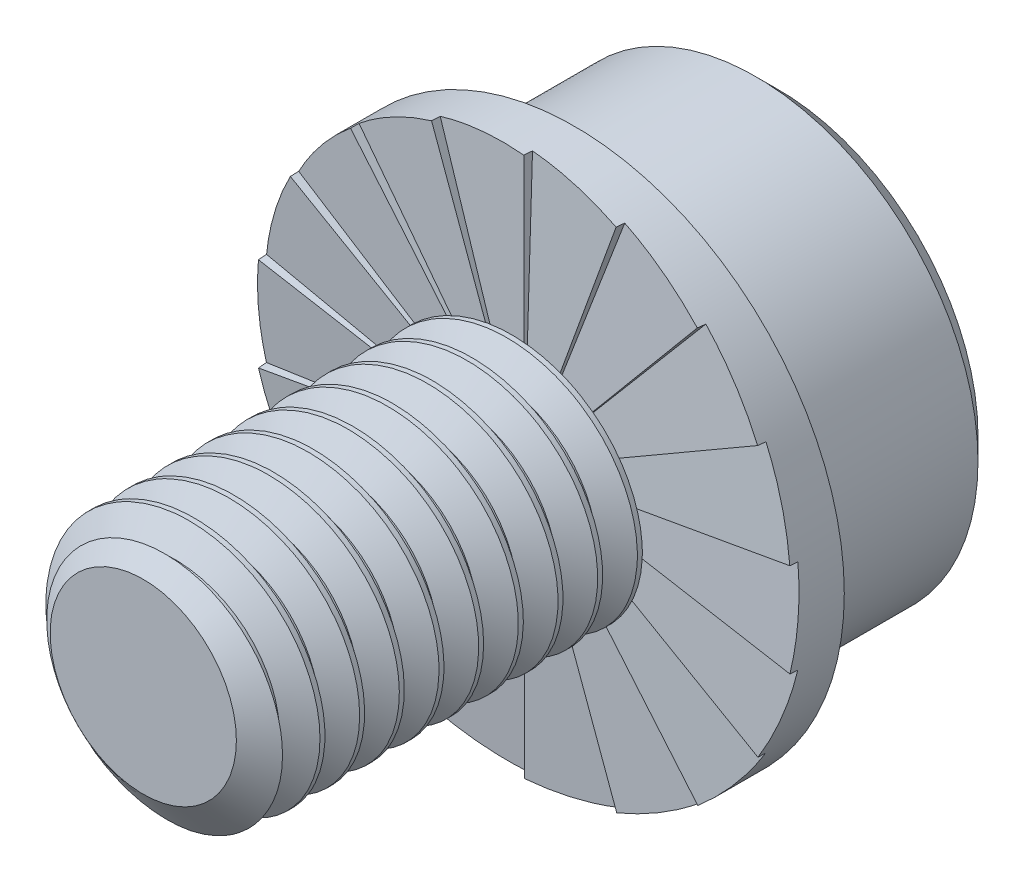
from build123d import *

# Parameters (mm, degrees)
SKETCH1_R           = 4
EXTRUDE1_DEPTH      = 12
CUT_SWEEP1_PITCH    = 1.25
SKETCH6_R           = 7
EXTRUDE2_DEPTH      = 8
SKETCH10_R          = 8.5
BOSS_EXTRUDE1_DEPTH = 1.5875
CUT_EXTRUDE5_DEPTH  = 1.5875
CIRPATTERN1_COUNT   = 18
BOSS_EXTRUDE2_REACH = 18.985
CUT_EXTRUDE1_DEPTH  = 4.5
CHAMFER1_SIZE       = 0.7
FILLET1_R           = 0.396875


with BuildPart() as part:
    # Sketch1 → Extrude1 (new body)
    with BuildSketch(Plane.XY):
        Circle(SKETCH1_R)
    extrude(amount=-EXTRUDE1_DEPTH)

    # Cut-Sweep1: the profile of Sketch3 profile screwed along a right-hand helix of 10.6 turns, 6 arcs to a turn; built about Z, then put on its axis
    cut_sweep1_z = Axis((0, 0, 0), (0, 0, 1))
    cut_sweep1_corners = [(4.0003, 0, -1.093923205), (3.188101184, 0, -0.625), (3.188101184, 0, -0.46875), (4.0003, 0, 0.000173205)]
    with BuildLine(mode=Mode.PRIVATE) as cut_sweep1_profile:
        Line(cut_sweep1_corners[0], cut_sweep1_corners[1])
        Line(cut_sweep1_corners[1], cut_sweep1_corners[2])
        Line(cut_sweep1_corners[2], cut_sweep1_corners[3])
        Line(cut_sweep1_corners[3], cut_sweep1_corners[0])
    cut_sweep1_cap = Face(cut_sweep1_profile.wire())
    cut_sweep1_turn_angles = [0, 30, 60, 90, 120, 150, 180, 210, 240, 270, 300, 330, 360]
    cut_sweep1_turn_weights = [1, 0.8660254037844387, 1, 0.8660254037844387, 1, 0.8660254037844387, 1, 0.8660254037844387, 1, 0.8660254037844387, 1, 0.8660254037844387, 1]
    cut_sweep1_turn_rails = [Edge.make_bspline([Vector(p[0], p[1], 0).rotate(cut_sweep1_z, cut_sweep1_turn_angles[k]) / cut_sweep1_turn_weights[k] + Vector(0, 0, p[2] + CUT_SWEEP1_PITCH * cut_sweep1_turn_angles[k] / 360) for k in range(13)], [0, 0, 0, 1, 1, 2, 2, 3, 3, 4, 4, 5, 5, 6, 6, 6], 2, cut_sweep1_turn_weights) for p in cut_sweep1_corners]
    cut_sweep1_turn_sides = [Face.make_surface_from_curves(cut_sweep1_turn_rails[p[0]], cut_sweep1_turn_rails[p[1]]) for p in [(0, 1), (1, 2), (2, 3), (3, 0)]]
    cut_sweep1_last_angles = [3600, 3630, 3660, 3690, 3720, 3750, 3780, 3798, 3816]
    cut_sweep1_last_weights = [1, 0.8660254037844387, 1, 0.8660254037844387, 1, 0.8660254037844387, 1, 0.9510565162950726, 1]
    cut_sweep1_last_rails = [Edge.make_bspline([Vector(p[0], p[1], 0).rotate(cut_sweep1_z, cut_sweep1_last_angles[k]) / cut_sweep1_last_weights[k] + Vector(0, 0, p[2] + CUT_SWEEP1_PITCH * cut_sweep1_last_angles[k] / 360) for k in range(9)], [0, 0, 0, 1, 1, 2, 2, 3, 3, 4, 4, 4], 2, cut_sweep1_last_weights) for p in cut_sweep1_corners]
    cut_sweep1_last_sides = [Face.make_surface_from_curves(cut_sweep1_last_rails[p[0]], cut_sweep1_last_rails[p[1]]) for p in [(0, 1), (1, 2), (2, 3), (3, 0)]]
    cut_sweep1 = Plane(origin=(0, 0, 0), x_dir=(0, 1, 0), z_dir=(0, 0, -1)) * Solid(Shell([*[p.moved(Location((0, 0, CUT_SWEEP1_PITCH * i))) for i in range(10) for p in cut_sweep1_turn_sides], *cut_sweep1_last_sides, cut_sweep1_cap, cut_sweep1_cap.rotate(cut_sweep1_z, 3816).moved(Location((0, 0, CUT_SWEEP1_PITCH * 3816 / 360)))]))
    add(cut_sweep1, mode=Mode.SUBTRACT)

    # Sketch4 → Cut-Revolve1 (revolve, cut)
    with BuildSketch(Plane(origin=(0, 0, 0), x_dir=(0, 0, -1), z_dir=(1, 0, 0)), mode=Mode.PRIVATE) as cut_revolve1_sk:
        Polygon((0.746350386, 4), (0, 2.934101184), (0, 4), align=None)
    revolve(cut_revolve1_sk.sketch.rotate(Axis((0, 0, 0), (0, 0, -1)), 230.713364492), axis=Axis((0, 0, 0), (0, 0, -1)), mode=Mode.SUBTRACT)


with BuildPart() as body_2:
    # Sketch6 → Extrude2 (new body)
    with BuildSketch(Plane(origin=(0, 0, -12), x_dir=(-1, 0, 0), z_dir=(0, 0, -1))):
        Circle(SKETCH6_R)
    extrude(amount=EXTRUDE2_DEPTH)

    # Sketch10 → Boss-Extrude1 (add)
    with BuildSketch(Plane.XY.offset(-12)):
        Circle(SKETCH10_R)
    extrude(amount=-BOSS_EXTRUDE1_DEPTH)

    # Sketch19 → Cut-Extrude5 (cut)
    with BuildSketch(Plane(origin=(1.041889066, 0, -11.908846518), x_dir=(-0.996194698091745, 0, -0.08715574274766483), z_dir=(0.08715574274766483, 0, -0.996194698091745))):
        with BuildLine():
            Line((1.045868913, 0), (1.045868913, 11.040000007))
            add(Edge.make_bspline(
                [(4.820493474, 10.370695747), (4.293893491, 10.563598892), (3.755613373, 10.715035313), (2.499804163, 10.967069667), (1.769198234, 11.039743484), (1.04847075, 11.039999769), (1.047169824, 11.040000002), (1.045868913, 11.040000007)],
                knots=[0.444410142, 0.444410142, 0.444410142, 0.444410142, 0.46875, 0.46875, 0.5, 0.5, 0.500056509, 0.500056509, 0.500056509, 0.500056509], degree=3))
            Line((4.820493474, 10.370695747), (1.045868913, 0))
        make_face()
    cut_extrude5 = extrude(amount=-CUT_EXTRUDE5_DEPTH, mode=Mode.SUBTRACT)

    # CirPattern1: Cut-Extrude5 ×18 about axis
    cirpattern1_axis = Axis((0, 0, 0), (0, 0, 1))
    for i in range(1, CIRPATTERN1_COUNT):
        add(cut_extrude5.rotate(cirpattern1_axis, i * 360 / CIRPATTERN1_COUNT), mode=Mode.SUBTRACT)

    # Sketch20 → Boss-Extrude2 (add, up to next)
    with BuildSketch(Plane(origin=(0, 0, -12), x_dir=(-1, 0, 0), z_dir=(0, 0, -1)), mode=Mode.PRIVATE) as boss_extrude2_sk1:
        with BuildLine():
            ThreePointArc((0.526884598, 3.144261722), (-0.723304973, 3.10496684), (-1.862157975, 2.587731987))
            add(Edge.make_bspline(
                [(-1.862157975, 2.587731987), (-2.17364247, 2.412836734), (-2.447338911, 2.19103351), (-2.918895309, 1.654506539), (-3.104302084, 1.35416688), (-3.386736723, 0.699146825), (-3.475561286, 0.358440886), (-3.549201291, -0.349167269), (-3.531980166, -0.702838694), (-3.321687629, -1.744026217), (-2.964512881, -2.389450193), (-2.228764673, -3.147183716), (-1.944769475, -3.368684214), (-1.336784561, -3.721037937), (-1.006307962, -3.856718566), (-0.661063834, -3.944996148)],
                knots=[0, 0, 0, 0, 0.125, 0.125, 0.25, 0.25, 0.375, 0.375, 0.5, 0.5, 0.75, 0.75, 0.875, 0.875, 1, 1, 1, 1], degree=3))
            ThreePointArc((-0.661063834, -3.944996148), (0.907505667, -3.895694221), (2.336385036, -3.246737588))
            add(Edge.make_bspline(
                [(2.336385036, -3.246737588), (2.606401027, -3.013104375), (2.839804309, -2.749326103), (3.136631009, -2.309792095), (3.2270414, -2.154710366), (3.384674688, -1.837832322), (3.451961626, -1.675294685), (3.61758748, -1.174800855), (3.68065369, -0.818599382), (3.696368475, -0.290097363), (3.688930753, -0.114131419), (3.648392837, 0.237392745), (3.614842155, 0.414056229), (3.523613804, 0.756138645), (3.465967612, 0.922684892), (3.326881561, 1.246888468), (3.244826841, 1.405520911), (2.965424055, 1.860552774), (2.739015365, 2.129747126), (2.332545825, 2.476642198), (2.187537173, 2.581273634), (1.885858847, 2.764183162), (1.728199863, 2.843327837), (1.398956073, 2.976480446), (1.2273356, 3.030162671), (0.881307792, 3.108334033), (0.705519501, 3.13345963), (0.526884598, 3.144261722)],
                knots=[0, 0, 0, 0, 0.125, 0.125, 0.1875, 0.1875, 0.25, 0.25, 0.375, 0.375, 0.4375, 0.4375, 0.5, 0.5, 0.5625, 0.5625, 0.625, 0.625, 0.75, 0.75, 0.8125, 0.8125, 0.875, 0.875, 0.9375, 0.9375, 1, 1, 1, 1], degree=3))
        make_face()
    boss_extrude2_tool1 = extrude(boss_extrude2_sk1.sketch, amount=BOSS_EXTRUDE2_REACH, mode=Mode.PRIVATE) - body_2.part

    add(part.part)  # Boss-Extrude2 merges part
    add(boss_extrude2_tool1.solids().sort_by_distance((-0.094166, -0.392848, -12))[0])

    # Sketch7 → Cut-Extrude1 (cut)
    with BuildSketch(Plane(origin=(0, 0, -20), x_dir=(-1, 0, 0), z_dir=(0, 0, -1))):
        Polygon((0, 3.464101615), (-3, 1.732050808), (-3, -1.732050808), (0, -3.464101615), (3, -1.732050808), (3, 1.732050808), align=None)
    extrude(amount=-CUT_EXTRUDE1_DEPTH, mode=Mode.SUBTRACT)

    # Cut-Extrude2 cone 1 section (through the dimple's axis) → Cut-Extrude2 (revolve, cut)
    with BuildSketch(Plane(origin=(0, 0, -20), x_dir=(0, 1, 0), z_dir=(1, 0, 0))):
        Polygon((0, 0), (3.464101615, 0), (0, 3.464101615), align=None)
    revolve(axis=Axis((0, 0, -20), (0, 0, 1)), mode=Mode.SUBTRACT)

    # Chamfer1
    chamfer1_edges = [body_2.edges().sort_by_distance(p)[0] for p in [
        (7, 0, -20),
    ]]
    chamfer(chamfer1_edges, length=CHAMFER1_SIZE)

    # Fillet1
    fillet1_edges = [body_2.edges().sort_by_distance(p)[0] for p in [
        (7, 0, -13.5875),
    ]]
    fillet(fillet1_edges, radius=FILLET1_R)


solid = body_2.part
